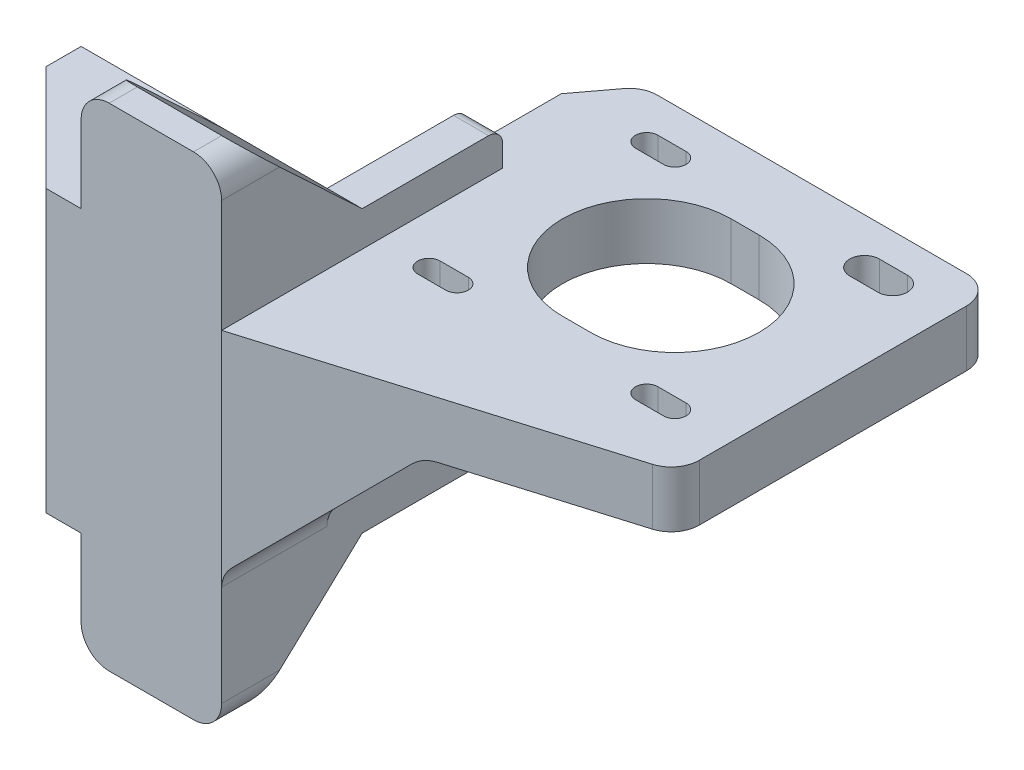
from build123d import *

# Parameters (mm, degrees)
SKETCH1_W                = 40
SKETCH1_H                = 40
BOSS_EXTRUDE1_DEPTH      = 40
SKETCH2_W                = 25
SKETCH2_H                = 20
CUT_EXTRUDE1_DEPTH       = 40
CHAMFER1_SIZE            = 15
CUT_EXTRUDE2_DEPTH       = 15
CHAMFER2_SIZE            = 4
SKETCH4_R                = 2.6
CUT_EXTRUDE3_DEPTH       = 17
BOSS_EXTRUDE3_DEPTH      = 20
FILLET3_R                = 4
BOSS_EXTRUDE2_DEPTH      = 20
BOSS_EXTRUDE2_DEPTH_BACK = 25
SKETCH5_W                = 50
SKETCH5_H                = 8
CUT_EXTRUDE4_DEPTH       = 10
CHAMFER3_SIZE            = 15
CHAMFER3_SIZE_2          = 20
CHAMFER4_SIZE2           = 50
CHAMFER4_SIZE            = 15
FILLET5_START            = 26
FILLET5_DEPTH            = 10
FILLET6_R                = 2
CHAMFER5_START           = -40
CHAMFER5_DEPTH           = 40
CHAMFER5_START_2         = 2
CHAMFER5_2_DEPTH         = 25
SKETCH11_W               = 27.237482008
SKETCH11_H               = 25
CUT_EXTRUDE5_DEPTH       = 25
FILLET7_R                = 4
SKETCH16_W               = 14
SKETCH16_H               = 14
CUT_EXTRUDE6_DEPTH       = 43
CHAMFER6_SIZE            = 2
CHAMFER6_SIZE2           = 10
FILLET9_R                = 2
CUT_EXTRUDE7_DEPTH       = 10


with BuildPart() as part:
    # Sketch1 → Boss-Extrude1 (new body)
    with BuildSketch(Plane(origin=(0, 0, 0), x_dir=(1, 0, 0), z_dir=(0, 1, 0))):
        with Locations((20, 20)):
            Rectangle(SKETCH1_W, SKETCH1_H)
    extrude(amount=BOSS_EXTRUDE1_DEPTH)

    # Sketch2 → Cut-Extrude1 (cut)
    with BuildSketch(Plane(origin=(0, 40, 0), x_dir=(1, 0, 0), z_dir=(0, 1, 0))):
        with Locations((12.5, 30)):
            Rectangle(SKETCH2_W, SKETCH2_H)
    extrude(amount=-CUT_EXTRUDE1_DEPTH, mode=Mode.SUBTRACT)

    # Chamfer1
    chamfer1_edges = [part.edges().sort_by_distance(p)[0] for p in [
        (0, 20, 0),
    ]]
    chamfer(chamfer1_edges, length=CHAMFER1_SIZE)

    # Sketch3 → Cut-Extrude2 (cut)
    with BuildSketch(Plane.XY):
        Polygon((0, 10), (0, 15), (15, 15), (15, 5), (0, 5), align=None)
        Polygon((0, 30), (0, 25), (15, 25), (15, 35), (0, 35), align=None)
    extrude(amount=-CUT_EXTRUDE2_DEPTH, mode=Mode.SUBTRACT)

    # Chamfer2
    chamfer2_edges = [part.edges().sort_by_distance(p)[0] for p in [
        (15, 35, -7.5),
        (15, 25, -7.5),
        (15, 15, -7.5),
        (15, 5, -7.5),
    ]]
    chamfer(chamfer2_edges, length=CHAMFER2_SIZE)

    # Sketch4 → Cut-Extrude3 (cut)
    with BuildSketch(Plane.XY.offset(-15)):
        with Locations((8, 30)):
            Circle(SKETCH4_R)
        with Locations((8, 10)):
            Circle(SKETCH4_R)
    extrude(amount=-CUT_EXTRUDE3_DEPTH, mode=Mode.SUBTRACT)

    # Sketch9 → Boss-Extrude3 (add)
    with BuildSketch(Plane(origin=(40, 0, 0), x_dir=(0, 0, -1), z_dir=(1, 0, 0))):
        Polygon((0, 40), (0, 55), (4, 55), (20, 40), align=None)
        Polygon((0, 0), (0, -15), (4, -15), (20, 0), align=None)
    extrude(amount=-BOSS_EXTRUDE3_DEPTH)

    # Fillet3
    fillet3_edges = [part.edges().sort_by_distance(p)[0] for p in [
        (20, 55, -2),
        (40, 55, -2),
        (20, -15, -2),
        (40, -15, -2),
    ]]
    fillet(fillet3_edges, radius=FILLET3_R)

    # Sketch5 → Boss-Extrude2 (add, two sides: drawn at the far end of the back side and taken through both)
    with BuildSketch(Plane(origin=(0, 0, -40), x_dir=(-1, 0, 0), z_dir=(0, 0, -1)).offset(-BOSS_EXTRUDE2_DEPTH_BACK)):
        with Locations((-65, 31)):
            Rectangle(SKETCH5_W, SKETCH5_H)
    extrude(amount=BOSS_EXTRUDE2_DEPTH + BOSS_EXTRUDE2_DEPTH_BACK)

    # Sketch10 → Cut-Extrude4 (cut)
    with BuildSketch(Plane(origin=(0, 27, 0), x_dir=(-1, 0, 0), z_dir=(0, -1, 0))):
        with BuildLine():
            ThreePointArc((-47, 51.9), (-45.4, 53.5), (-47, 55.1))
            Line((-47, 55.1), (-51, 55.1))
            ThreePointArc((-51, 55.1), (-52.13137085, 54.63137085), (-52.6, 53.5))
            ThreePointArc((-52.6, 53.5), (-52.13137085, 52.36862915), (-51, 51.9))
            Line((-51, 51.9), (-47, 51.9))
        make_face()
        with BuildLine():
            ThreePointArc((-47, 20.9), (-45.4, 22.5), (-47, 24.1))
            Line((-47, 24.1), (-51, 24.1))
            ThreePointArc((-51, 24.1), (-52.6, 22.5), (-51, 20.9))
            Line((-51, 20.9), (-47, 20.9))
        make_face()
        with BuildLine():
            ThreePointArc((-78, 20.9), (-76.4, 22.5), (-78, 24.1))
            Line((-78, 24.1), (-82, 24.1))
            ThreePointArc((-82, 24.1), (-83.6, 22.5), (-82, 20.9))
            Line((-82, 20.9), (-78, 20.9))
        make_face()
        with BuildLine():
            ThreePointArc((-66.5, 50), (-78.5, 38), (-66.5, 26))
            Line((-66.5, 26), (-62.5, 26))
            ThreePointArc((-62.5, 26), (-50.5, 38), (-62.5, 50))
            Line((-62.5, 50), (-66.5, 50))
        make_face()
        with BuildLine():
            ThreePointArc((-78, 51.4), (-75.9, 53.5), (-78, 55.6))
            Line((-78, 55.6), (-82, 55.6))
            ThreePointArc((-82, 55.6), (-84.1, 53.5), (-82, 51.4))
            Line((-82, 51.4), (-78, 51.4))
        make_face()
    extrude(amount=-CUT_EXTRUDE4_DEPTH, mode=Mode.SUBTRACT)

    # Chamfer3
    # the kernel refuses this chamfer: 20, 15 mm, written as the material it adds along each edge
    with BuildSketch(Plane(origin=(40, 27, -40), x_dir=(-1, 0, 0), z_dir=(0, 1, 0))) as chamfer3_piece_1:
        Polygon((CHAMFER3_SIZE, 0), (0, -CHAMFER3_SIZE_2), (0, 0), align=None)
    extrude(amount=8)

    # Chamfer4
    chamfer4_edges = [part.edges().sort_by_distance(p)[0] for p in [
        (40, 31, -15),
    ]]
    chamfer4_side = [part.faces().sort_by_distance(p)[0] for p in [
        (40, 31, -14.7),
    ]]
    chamfer(chamfer4_edges, length=CHAMFER4_SIZE - 0.0001, length2=CHAMFER4_SIZE2 - 0.0001, reference=chamfer4_side[0])  # a hair under: the kernel refuses the full size

    # Fillet5: read off the stored shape, not the designer's step
    # Fillet5 outline → Fillet5 (cut)
    with BuildSketch(Plane(origin=(0, 0, 0), x_dir=(1, 0, 0), z_dir=(0, 1, 0)).offset(FILLET5_START)):
        with BuildLine():
            Line((90, 15), (90, 17.976122604))
            ThreePointArc((90, 17.976122604), (89.209171713, 15.588400485), (87.149391542, 14.144817463))
            Line((87.149391542, 14.144817463), (90, 15))
        make_face()
        with BuildLine():
            ThreePointArc((38.8, 58.4), (40.211145618, 59.577708764), (42, 60))
            Line((42, 60), (40, 60))
            Line((40, 60), (38.8, 58.4))
        make_face()
        with BuildLine():
            ThreePointArc((86, 60), (88.828427125, 58.828427125), (90, 56))
            Line((90, 56), (90, 60))
            Line((90, 60), (86, 60))
        make_face()
    extrude(amount=FILLET5_DEPTH, mode=Mode.SUBTRACT)

    # Fillet6
    fillet6_edges = [part.edges().sort_by_distance(p)[0] for p in [
        (32.5, 40, -40),
        (32.5, 0, -40),
    ]]
    fillet(fillet6_edges, radius=FILLET6_R)

    # Chamfer5: read off the stored shape, not the designer's step
    # Chamfer5 outline → Chamfer5 (add)
    with BuildSketch(Plane.XY.offset(CHAMFER5_START)):
        Polygon((40, 5), (62, 27), (40, 27), align=None)
    extrude(amount=CHAMFER5_DEPTH)

    # Chamfer5 2 outline → Chamfer5 2 (cut)
    with BuildSketch(Plane(origin=(0, 0, 0), x_dir=(1, 0, 0), z_dir=(0, 1, 0)).offset(CHAMFER5_START_2)):
        with BuildLine():
            Line((51, 24.1), (47, 24.1))
            ThreePointArc((47, 24.1), (45.4, 22.5), (47, 20.9))
            Line((47, 20.9), (51, 20.9))
            ThreePointArc((51, 20.9), (52.6, 22.5), (51, 24.1))
        make_face()
        with BuildLine():
            ThreePointArc((50.667840434, 40), (53.33484861, 30.254033308), (62.5, 26))
            Line((62.5, 26), (64, 26))
            Line((64, 26), (64, 40))
            Line((64, 40), (50.667840434, 40))
        make_face()
        Polygon((64, 0), (64, 7.2), (40, 0), align=None)
    extrude(amount=CHAMFER5_2_DEPTH, mode=Mode.SUBTRACT)

    # Sketch11 → Cut-Extrude5 (cut)
    with BuildSketch(Plane(origin=(0, 0, -40), x_dir=(-1, 0, 0), z_dir=(0, 0, -1))):
        with Locations((-53.618741004, 14.5)):
            Rectangle(SKETCH11_W, SKETCH11_H)
    extrude(amount=-CUT_EXTRUDE5_DEPTH, mode=Mode.SUBTRACT)

    # Fillet7
    fillet7_edges = [part.edges().sort_by_distance(p)[0] for p in [
        (62, 27, -10.8000346),
        (40, 5, -7.5),
    ]]
    fillet(fillet7_edges, radius=FILLET7_R)

    # Sketch16 → Cut-Extrude6 (cut)
    with BuildSketch(Plane.ZY):
        with Locations((-29, 20)):
            Rectangle(SKETCH16_W, SKETCH16_H)
    extrude(amount=-CUT_EXTRUDE6_DEPTH, mode=Mode.SUBTRACT)

    # Chamfer6
    chamfer6_edges = [part.edges().sort_by_distance(p)[0] for p in [
        (40, 20, -36),
    ]]
    chamfer6_side = [part.faces().sort_by_distance(p)[0] for p in [
        (40, 6.638609855, -21.034394019),
    ]]
    chamfer(chamfer6_edges, length=CHAMFER6_SIZE, length2=CHAMFER6_SIZE2, reference=chamfer6_side[0])

    # Fillet9
    fillet9_edges = [part.edges().sort_by_distance(p)[0] for p in [
        (32.5, 13, -22),
        (32.5, 27, -22),
        (27.5, 27, -36),
        (27.5, 13, -36),
        (35, 13, -37),
        (35, 27, -37),
    ]]
    fillet(fillet9_edges, radius=FILLET9_R)

    # Sketch17 → Cut-Extrude7 (cut)
    with BuildSketch(Plane.ZY.offset(-25)):
        Polygon((-20, 0), (-20, 45.439025914), (-90.041383554, 45.439025914), (-90.041383554, -69.890024076), align=None)
    extrude(amount=-CUT_EXTRUDE7_DEPTH, mode=Mode.SUBTRACT)


solid = part.part
